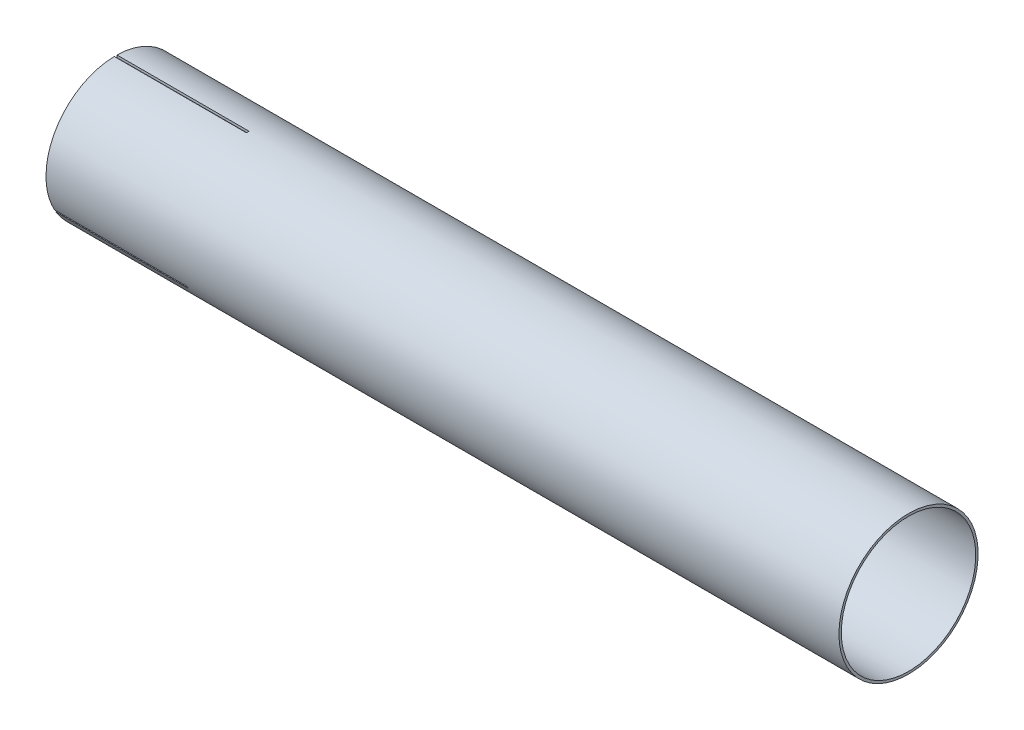
from build123d import *

# Parameters (mm, degrees)
ESQUISSE1_W                  = 900
ESQUISSE1_H                  = 2.71
ESQUISSE2_W                  = 150
ESQUISSE2_H                  = 3
ENL_V_MAT_EXTRU_1_DEPTH      = 907.907933585
R_P_TITION_CIRCULAIRE1_COUNT = 3
R_P_TITION_CIRCULAIRE1_ANGLE = 240


with BuildPart() as part:
    # Esquisse1 → Révolution1 (revolve)
    with BuildSketch(Plane.XY):
        with Locations((450, 77.645)):
            Rectangle(ESQUISSE1_W, ESQUISSE1_H)
    revolve(axis=Axis((0, 0, 0), (1, 0, 0)))

    # Esquisse2 → Enlèv. mat.-Extru.1 (cut, through all)
    with BuildSketch(Plane(origin=(0, 0, 0), x_dir=(1, 0, 0), z_dir=(0, 1, 0))):
        with Locations((75, 0)):
            Rectangle(ESQUISSE2_W, ESQUISSE2_H)
    enl_v_mat_extru_1 = extrude(amount=ENL_V_MAT_EXTRU_1_DEPTH, mode=Mode.SUBTRACT)

    # Répétition circulaire1: Enlèv. mat.-Extru.1 ×3 about axis
    r_p_tition_circulaire1_axis = Axis((900, 0, 0), (-1, 0, 0))
    for i in range(1, R_P_TITION_CIRCULAIRE1_COUNT):
        add(enl_v_mat_extru_1.rotate(r_p_tition_circulaire1_axis, i * R_P_TITION_CIRCULAIRE1_ANGLE / (R_P_TITION_CIRCULAIRE1_COUNT - 1)), mode=Mode.SUBTRACT)


solid = part.part
